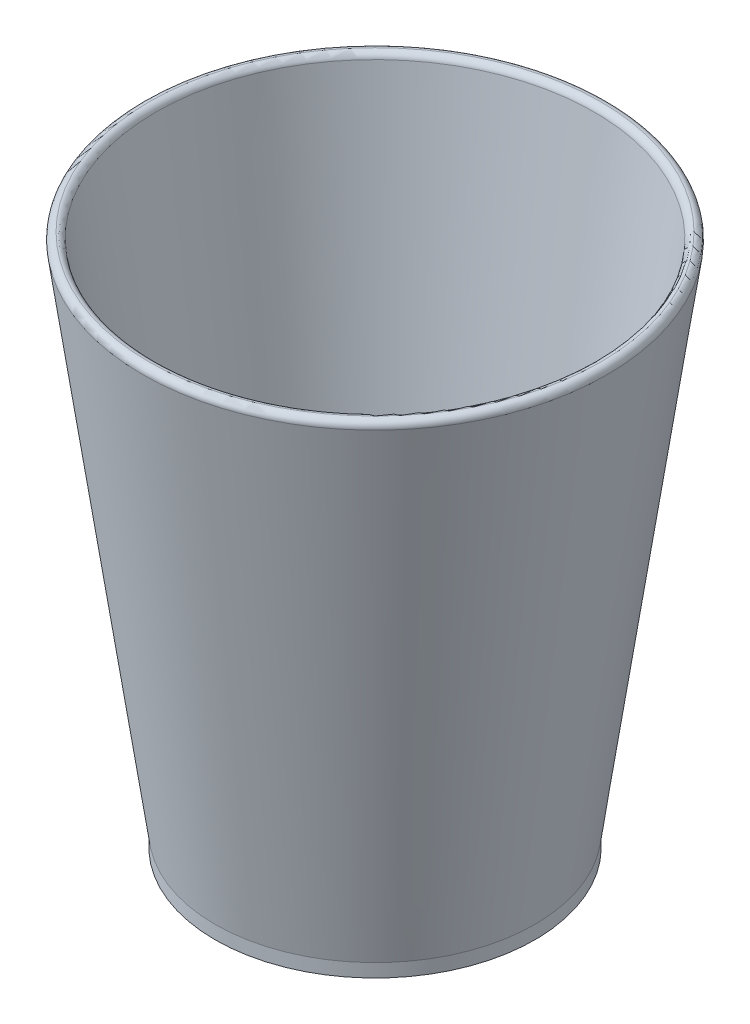
from build123d import *

# Parameters (mm, degrees)
CROQUIS1_R              = 24
SALIENTE_EXTRUIR1_DEPTH = 2
REDONDEO1_R             = 1
REDONDEO2_R             = 1


with BuildPart() as part:
    # Croquis1 → Saliente-Extruir1 (new body)
    with BuildSketch(Plane(origin=(0, 0, 0), x_dir=(1, 0, 0), z_dir=(0, 1, 0))):
        with Locations(Location((0, 0, 0), (0, 0, 270))):
            Circle(CROQUIS1_R)
    extrude(amount=SALIENTE_EXTRUIR1_DEPTH)

    # Croquis2 → Revolución1 (revolve)
    with BuildSketch(Plane.XY, mode=Mode.PRIVATE) as revoluci_n1_sk:
        Polygon((24, 2), (35, 80), (33, 80), (22, 2), align=None)
    revolve(revoluci_n1_sk.sketch.rotate(Axis((0, 2, 0), (0, 1, 0)), 270), axis=Axis((0, 2, 0), (0, 1, 0)))

    # Redondeo1
    redondeo1_edges = [part.edges().sort_by_distance(p)[0] for p in [
        (0, 80, -35),
    ]]
    fillet(redondeo1_edges, radius=REDONDEO1_R)

    # Redondeo2
    # the kernel refuses this fillet: 1 mm, written as the material it takes off along each edge
    with BuildSketch(Plane(origin=(0, 80, 0), x_dir=(0, 0, 1), z_dir=(-1, 0, 0))) as redondeo2_piece_1:
        with BuildLine():
            CenterArc((33 + REDONDEO2_R * 0.868869517606, -REDONDEO2_R), REDONDEO2_R, 90, 81.97276249)
            Line((33 - REDONDEO2_R * 0.121332278545, -REDONDEO2_R * 0.860356156953), (33, 0))
            Line((33, 0), (33 + REDONDEO2_R * 0.868869517606, 0))
        make_face()
    revolve(axis=Axis((0, 80, 0), (0, 1, 0)), mode=Mode.SUBTRACT)


solid = part.part
